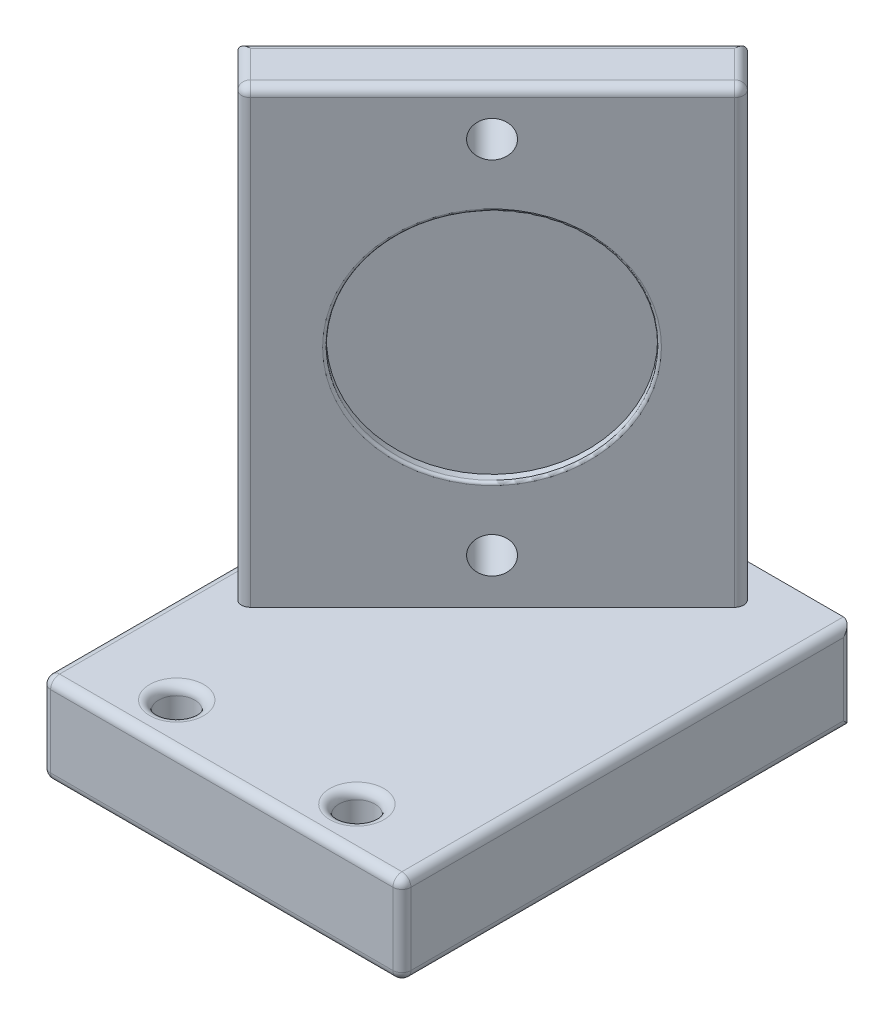
from build123d import *

# Parameters (mm, degrees)
SKETCH_1_R          = 2
EXTRUDE_1_DEPTH     = 10
EXTRUDE_2_DEPTH     = 60
SKETCH_2_R          = 13
CUT_EXTRUDE_1_DEPTH = 1.1
FILLET_1_R          = 0.3
FILLET_2_R          = 1
SKETCH_2_3_R        = 2
CUT_EXTRUDE_2_DEPTH = 71.751134663


with BuildPart() as part:
    # 草图1 → 凸台-拉伸1 (new body)
    with BuildSketch(Plane(origin=(0, 0, 0), x_dir=(1, 0, 0), z_dir=(0, 1, 0))):
        Polygon((2.566075632, 42.89482758), (-10.586870806, 42.89482758), (-37.433924368, 15.89482758), (-37.433924368, -7.10517242), (-17.433924368, -7.10517242), (2.566075632, -7.10517242), align=None)
        with Locations(Location((-27.433924368, -2.10517242, 0), (0, 0, 270))):
            Circle(SKETCH_1_R, mode=Mode.SUBTRACT)
        with Locations(Location((-7.433924368, -2.10517242, 0), (0, 0, 270))):
            Circle(SKETCH_1_R, mode=Mode.SUBTRACT)
    extrude(amount=EXTRUDE_1_DEPTH)

    # 草图1<3> → 凸台-拉伸2 (add)
    with BuildSketch(Plane(origin=(0, 0, 0), x_dir=(1, 0, 0), z_dir=(0, 1, 0))):
        Polygon((-32.960298008, 10.196881065), (-37.403948822, 14.640531879), (-23.261813198, 28.782667503), (-9.119677574, 42.924803127), (-4.67602676, 38.481152313), align=None)
        Polygon((-9.149653121, 42.89482758), (-23.261813198, 28.782667503), (-37.403948822, 14.640531879), (-32.960298008, 10.196881065), (-4.67602676, 38.481152313), (-9.089702028, 42.89482758), align=None)
    extrude(amount=EXTRUDE_2_DEPTH)

    # 草图2 → 切除-拉伸1 (cut)
    with BuildSketch(Plane(origin=(-21.578589537, 0, -21.578589537), x_dir=(0.7071067811865472, 0, -0.7071067811865478), z_dir=(0.7071067811865478, 0, 0.7071067811865472))):
        with Locations((3.861441693, 35)):
            Circle(SKETCH_2_R)
    extrude(amount=-CUT_EXTRUDE_1_DEPTH, mode=Mode.SUBTRACT)

    # 圆角1
    fillet_1_edges = [part.edges().sort_by_distance(p)[0] for p in [
        (-28.040526086, 35, -15.116652987),
    ]]
    fillet(fillet_1_edges, radius=FILLET_1_R)

    # 圆角2
    # the kernel refuses this fillet: 1 mm, written as the material it takes off along each edge
    with BuildSketch(Plane(origin=(-36.433924368, 1, 6.10517242), x_dir=(-1, 0, 0), z_dir=(0, -1, 0))) as fillet_2_piece_1_section:
        Polygon((0, 0), (FILLET_2_R, 0), (FILLET_2_R, -FILLET_2_R), (0, -FILLET_2_R), align=None)
    fillet_2_piece_1 = extrude(amount=FILLET_2_R, mode=Mode.PRIVATE)
    fillet_2_piece_1 = fillet_2_piece_1 - Plane(origin=(-36.433924368, 1, 6.10517242), x_dir=(0.7071067811865475, 0, -0.7071067811865475), z_dir=(0, -1, 0)) * Sphere(FILLET_2_R, mode=Mode.PRIVATE)
    add(fillet_2_piece_1, mode=Mode.SUBTRACT)
    with BuildSketch(Plane(origin=(1.566075632, 1, 6.10517242), x_dir=(1, 0, 0), z_dir=(0, -1, 0))) as fillet_2_piece_2_section:
        Polygon((0, 0), (FILLET_2_R, 0), (FILLET_2_R, FILLET_2_R), (0, FILLET_2_R), align=None)
    fillet_2_piece_2 = extrude(amount=FILLET_2_R, mode=Mode.PRIVATE)
    fillet_2_piece_2 = fillet_2_piece_2 - Plane(origin=(1.566075632, 1, 6.10517242), x_dir=(-0.7071067811865475, 0, -0.7071067811865475), z_dir=(0, -1, 0)) * Sphere(FILLET_2_R, mode=Mode.PRIVATE)
    add(fillet_2_piece_2, mode=Mode.SUBTRACT)
    with BuildSketch(Plane(origin=(-36.433924368, 9, 6.10517242), x_dir=(0, 1, 0), z_dir=(-1, 0, 0))) as fillet_2_piece_3_section:
        Polygon((0, 0), (FILLET_2_R, 0), (FILLET_2_R, -FILLET_2_R), (0, -FILLET_2_R), align=None)
    fillet_2_piece_3 = extrude(amount=FILLET_2_R, mode=Mode.PRIVATE)
    fillet_2_piece_3 = fillet_2_piece_3 - Plane(origin=(-36.433924368, 9, 6.10517242), x_dir=(0, -0.7071067811865475, -0.7071067811865475), z_dir=(-1, 0, 0)) * Sphere(FILLET_2_R, mode=Mode.PRIVATE)
    add(fillet_2_piece_3, mode=Mode.SUBTRACT)
    with BuildSketch(Plane(origin=(1.566075632, 9, 6.10517242), x_dir=(1, 0, 0), z_dir=(0, 1, 0))) as fillet_2_piece_4_section:
        Polygon((0, 0), (FILLET_2_R, 0), (FILLET_2_R, -FILLET_2_R), (0, -FILLET_2_R), align=None)
    fillet_2_piece_4 = extrude(amount=FILLET_2_R, mode=Mode.PRIVATE)
    fillet_2_piece_4 = fillet_2_piece_4 - Plane(origin=(1.566075632, 9, 6.10517242), x_dir=(-0.7071067811865475, 0, -0.7071067811865475), z_dir=(0, 1, 0)) * Sphere(FILLET_2_R, mode=Mode.PRIVATE)
    add(fillet_2_piece_4, mode=Mode.SUBTRACT)
    with BuildSketch(Plane(origin=(-6.090240323, 59, -38.481152313), x_dir=(0.7071067811865481, 0, -0.707106781186547), z_dir=(0.7071067811865475, 0, 0.7071067811865476))) as fillet_2_piece_5_section:
        Polygon((0, 0), (FILLET_2_R, 0), (FILLET_2_R, FILLET_2_R), (0, FILLET_2_R), align=None)
    fillet_2_piece_5 = extrude(amount=FILLET_2_R, mode=Mode.PRIVATE)
    fillet_2_piece_5 = fillet_2_piece_5 - Plane(origin=(-6.090240323, 59, -38.481152313), x_dir=(-0.5000000000000004, -0.7071067811865475, 0.4999999999999996), z_dir=(0.7071067811865475, 0, 0.7071067811865476)) * Sphere(FILLET_2_R, mode=Mode.PRIVATE)
    add(fillet_2_piece_5, mode=Mode.SUBTRACT)
    with BuildSketch(Plane(origin=(-32.960298008, 59, -11.611094628), x_dir=(-0.707106781186548, 0, 0.7071067811865471), z_dir=(0.7071067811865475, 0, 0.7071067811865476))) as fillet_2_piece_6_section:
        Polygon((0, 0), (FILLET_2_R, 0), (FILLET_2_R, -FILLET_2_R), (0, -FILLET_2_R), align=None)
    fillet_2_piece_6 = extrude(amount=FILLET_2_R, mode=Mode.PRIVATE)
    fillet_2_piece_6 = fillet_2_piece_6 - Plane(origin=(-32.960298008, 59, -11.611094628), x_dir=(0.5000000000000003, -0.7071067811865475, -0.49999999999999967), z_dir=(0.7071067811865475, 0, 0.7071067811865476)) * Sphere(FILLET_2_R, mode=Mode.PRIVATE)
    add(fillet_2_piece_6, mode=Mode.SUBTRACT)
    with BuildSketch(Plane(origin=(-7.433924368, 10, 2.10517242), x_dir=(0, 0, 1), z_dir=(-1, 0, 0))) as fillet_2_piece_7:
        with BuildLine():
            CenterArc((2 + FILLET_2_R, -FILLET_2_R), FILLET_2_R, 90, 90)
            Line((2, -FILLET_2_R), (2, 0))
            Line((2, 0), (2 + FILLET_2_R, 0))
        make_face()
    revolve(axis=Axis((-7.433924368, 10, 2.10517242), (0, 1, 0)), mode=Mode.SUBTRACT)
    with BuildSketch(Plane(origin=(-36.433924368, 0, 7.10517242), x_dir=(0, 1, 0), z_dir=(1, 0, 0)), Plane(origin=(-5.383133542, 60, -37.774045532), x_dir=(0, -1, 0), z_dir=(-0.7071067811865476, 0, 0.7071067811865475))) as fillet_2_piece_8:
        with BuildLine():
            CenterArc((FILLET_2_R, -FILLET_2_R), FILLET_2_R, 90, 90)
            Line((0, -FILLET_2_R), (0, 0))
            Line((0, 0), (FILLET_2_R, 0))
        make_face()
    extrude(amount=38, mode=Mode.SUBTRACT)
    with BuildSketch(Plane(origin=(-37.433924368, 0, -18.39482758), x_dir=(0, 1, 0), z_dir=(0, 0, 1))) as fillet_2_piece_9:
        with BuildLine():
            CenterArc((FILLET_2_R, -FILLET_2_R), FILLET_2_R, 90, 90)
            Line((0, -FILLET_2_R), (0, 0))
            Line((0, 0), (FILLET_2_R, 0))
        make_face()
    extrude(amount=24.5, mode=Mode.SUBTRACT)
    with BuildSketch(Plane(origin=(-37.433924368, 10, -18.39482758), x_dir=(1, 0, 0), z_dir=(0, 0, 1))) as fillet_2_piece_10_section:
        with BuildLine():
            CenterArc((FILLET_2_R, -FILLET_2_R), FILLET_2_R, 90, 90)
            Line((0, -FILLET_2_R), (0, 0))
            Line((0, 0), (FILLET_2_R, 0))
        make_face()
    fillet_2_piece_10 = extrude(amount=24.5, mode=Mode.PRIVATE)
    fillet_2_piece_10 = split(fillet_2_piece_10, bisect_by=Plane(origin=(-36.324921122, 9.766519009, -15.719559578), z_dir=(-0.7071067811865477, 0, -0.7071067811865474)), keep=Keep.TOP, mode=Mode.PRIVATE)
    fillet_2_piece_10 = split(fillet_2_piece_10, bisect_by=Plane(origin=(-38.299035866, 9.766519009, -15.535618924), z_dir=(0.707106781186548, 0, -0.7071067811865471)), keep=Keep.TOP, mode=Mode.PRIVATE)
    add(fillet_2_piece_10, mode=Mode.SUBTRACT)
    with BuildSketch(Plane(origin=(-37.433924368, 10, -18.39482758), x_dir=(1, 0, 0), z_dir=(0, 0, 1))) as fillet_2_piece_11_section:
        with BuildLine():
            CenterArc((FILLET_2_R, -FILLET_2_R), FILLET_2_R, 90, 90)
            Line((0, -FILLET_2_R), (0, 0))
            Line((0, 0), (FILLET_2_R, 0))
        make_face()
    fillet_2_piece_11 = extrude(amount=24.5, mode=Mode.PRIVATE)
    fillet_2_piece_11 = split(fillet_2_piece_11, bisect_by=Plane(origin=(-37.42099653, 9.530875179, -14.623484171), z_dir=(-0.7071067811865477, 0, -0.7071067811865474)), keep=Keep.TOP, mode=Mode.PRIVATE)
    fillet_2_piece_11 = split(fillet_2_piece_11, bisect_by=Plane(origin=(-37.42099653, 9.530875179, -14.657579587), z_dir=(-0.707106781186548, 0, 0.7071067811865471)), keep=Keep.TOP, mode=Mode.PRIVATE)
    add(fillet_2_piece_11, mode=Mode.SUBTRACT)
    with BuildSketch(Plane(origin=(-37.433924368, 10, -18.39482758), x_dir=(1, 0, 0), z_dir=(0, 0, 1))) as fillet_2_piece_12_section:
        with BuildLine():
            CenterArc((FILLET_2_R, -FILLET_2_R), FILLET_2_R, 90, 90)
            Line((0, -FILLET_2_R), (0, 0))
            Line((0, 0), (FILLET_2_R, 0))
        make_face()
    fillet_2_piece_12 = extrude(amount=24.5, mode=Mode.PRIVATE)
    fillet_2_piece_12 = split(fillet_2_piece_12, bisect_by=Plane(origin=(-42.544211764, 9.772380765, -9.500268936), z_dir=(0.7071067811865477, 0, 0.7071067811865474)), keep=Keep.TOP, mode=Mode.PRIVATE)
    fillet_2_piece_12 = split(fillet_2_piece_12, bisect_by=Plane(origin=(-32.069422105, 9.772380765, -9.306005163), z_dir=(-0.707106781186548, 0, 0.7071067811865471)), keep=Keep.TOP, mode=Mode.PRIVATE)
    add(fillet_2_piece_12, mode=Mode.SUBTRACT)
    with BuildSketch(Plane(origin=(-37.433924368, -1.03137671, -15.89482758), x_dir=(0, 0, 1), z_dir=(0, 1, 0))) as fillet_2_piece_13:
        with BuildLine():
            CenterArc((FILLET_2_R * 0.412550684114, FILLET_2_R), FILLET_2_R, 225.162741715, 44.837258285)
            Line((-FILLET_2_R * 0.29254479632, FILLET_2_R * 0.290887622818), (0, 0))
            Line((0, 0), (FILLET_2_R * 0.412550684114, 0))
        make_face()
    extrude(amount=12.062753421, mode=Mode.SUBTRACT)
    with BuildSketch(Plane(origin=(2.566075632, -2.5, -42.89482758), x_dir=(-1, 0, 0), z_dir=(0, 1, 0))) as fillet_2_piece_14:
        with BuildLine():
            CenterArc((FILLET_2_R, FILLET_2_R), FILLET_2_R, 180, 90)
            Line((0, FILLET_2_R), (0, 0))
            Line((0, 0), (FILLET_2_R, 0))
        make_face()
    extrude(amount=15, mode=Mode.SUBTRACT)
    with BuildSketch(Plane(origin=(2.566075632, 1, 7.10517242), x_dir=(-1, 0, 0), z_dir=(0, 1, 0))) as fillet_2_piece_15:
        with BuildLine():
            CenterArc((FILLET_2_R, -FILLET_2_R), FILLET_2_R, 90, 90)
            Line((0, -FILLET_2_R), (0, 0))
            Line((0, 0), (FILLET_2_R, 0))
        make_face()
    extrude(amount=8, mode=Mode.SUBTRACT)
    with BuildSketch(Plane(origin=(-37.433924368, 1, 7.10517242), x_dir=(1, 0, 0), z_dir=(0, 1, 0))) as fillet_2_piece_16:
        with BuildLine():
            CenterArc((FILLET_2_R, FILLET_2_R), FILLET_2_R, 180, 90)
            Line((0, FILLET_2_R), (0, 0))
            Line((0, 0), (FILLET_2_R, 0))
        make_face()
    extrude(amount=8, mode=Mode.SUBTRACT)
    with BuildSketch(Plane(origin=(1.566075632, 10, 7.10517242), x_dir=(0, 0, -1), z_dir=(-1, 0, 0))) as fillet_2_piece_17:
        with BuildLine():
            CenterArc((FILLET_2_R, FILLET_2_R), FILLET_2_R, 180, 90)
            Line((0, FILLET_2_R), (0, 0))
            Line((0, 0), (FILLET_2_R, 0))
        make_face()
    extrude(amount=38, mode=Mode.SUBTRACT)
    with BuildSketch(Plane(origin=(2.566075632, 10, 6.10517242), x_dir=(-1, 0, 0), z_dir=(0, 0, -1)), Plane(origin=(2.566075632, 0, 6.10517242), x_dir=(0, 1, 0), z_dir=(0, 0, -1))) as fillet_2_piece_18:
        with BuildLine():
            CenterArc((FILLET_2_R, -FILLET_2_R), FILLET_2_R, 90, 90)
            Line((0, -FILLET_2_R), (0, 0))
            Line((0, 0), (FILLET_2_R, 0))
        make_face()
    extrude(amount=51.5, mode=Mode.SUBTRACT)
    with BuildSketch(Plane(origin=(-5.383133542, 60, -39.188259094), x_dir=(0, -1, 0), z_dir=(-0.707106781186547, 0, -0.7071067811865481))) as fillet_2_piece_19:
        with BuildLine():
            CenterArc((FILLET_2_R, FILLET_2_R), FILLET_2_R, 180, 90)
            Line((0, FILLET_2_R), (0, 0))
            Line((0, 0), (FILLET_2_R, 0))
        make_face()
    extrude(amount=7.784271247, mode=Mode.SUBTRACT)
    with BuildSketch(Plane(origin=(-4.67602676, 10, -38.481152313), x_dir=(-0.7071067811865467, 0, 0.7071067811865485), z_dir=(0, 1, 0))) as fillet_2_piece_20:
        with BuildLine():
            CenterArc((FILLET_2_R, -FILLET_2_R), FILLET_2_R, 90, 90)
            Line((0, -FILLET_2_R), (0, 0))
            Line((0, 0), (FILLET_2_R, 0))
        make_face()
    extrude(amount=49, mode=Mode.SUBTRACT)
    with BuildSketch(Plane(origin=(-39.171715775, 60, -12.872764926), x_dir=(0.7071067811865477, 0, 0.7071067811865475), z_dir=(0.7071067811865475, 0, -0.7071067811865477))) as fillet_2_piece_21:
        with BuildLine():
            CenterArc((FILLET_2_R, FILLET_2_R), FILLET_2_R, 180, 90)
            Line((0, FILLET_2_R), (0, 0))
            Line((0, 0), (FILLET_2_R, 0))
        make_face()
    extrude(amount=45, mode=Mode.SUBTRACT)
    with BuildSketch(Plane(origin=(-33.667404789, 60, -10.903987846), x_dir=(0, -1, 0), z_dir=(-0.7071067811865471, 0, -0.707106781186548))) as fillet_2_piece_22:
        with BuildLine():
            CenterArc((FILLET_2_R, -FILLET_2_R), FILLET_2_R, 90, 90)
            Line((0, -FILLET_2_R), (0, 0))
            Line((0, 0), (FILLET_2_R, 0))
        make_face()
    extrude(amount=7.784271247, mode=Mode.SUBTRACT)
    with BuildSketch(Plane(origin=(-32.960298008, 10, -10.196881065), x_dir=(0.7071067811865502, 0, -0.7071067811865449), z_dir=(0, 1, 0))) as fillet_2_piece_23:
        with BuildLine():
            CenterArc((FILLET_2_R, FILLET_2_R), FILLET_2_R, 180, 90)
            Line((0, FILLET_2_R), (0, 0))
            Line((0, 0), (FILLET_2_R, 0))
        make_face()
    extrude(amount=49, mode=Mode.SUBTRACT)
    with BuildSketch(Plane(origin=(-27.433924368, 10, 2.10517242), x_dir=(0, 0, 1), z_dir=(-1, 0, 0))) as fillet_2_piece_24:
        with BuildLine():
            CenterArc((2 + FILLET_2_R, -FILLET_2_R), FILLET_2_R, 90, 90)
            Line((2, -FILLET_2_R), (2, 0))
            Line((2, 0), (2 + FILLET_2_R, 0))
        make_face()
    revolve(axis=Axis((-27.433924368, 10, 2.10517242), (0, 1, 0)), mode=Mode.SUBTRACT)

    # 草图2<3> → 切除-拉伸2 (cut, through all)
    with BuildSketch(Plane(origin=(-21.578589537, 0, -21.578589537), x_dir=(0.7071067811865472, 0, -0.7071067811865478), z_dir=(0.7071067811865478, 0, 0.7071067811865472))):
        with Locations((3.861441693, 55)):
            Circle(SKETCH_2_3_R)
        with Locations((3.861441693, 15)):
            Circle(SKETCH_2_3_R)
    extrude(amount=-CUT_EXTRUDE_2_DEPTH, mode=Mode.SUBTRACT)


solid = part.part
